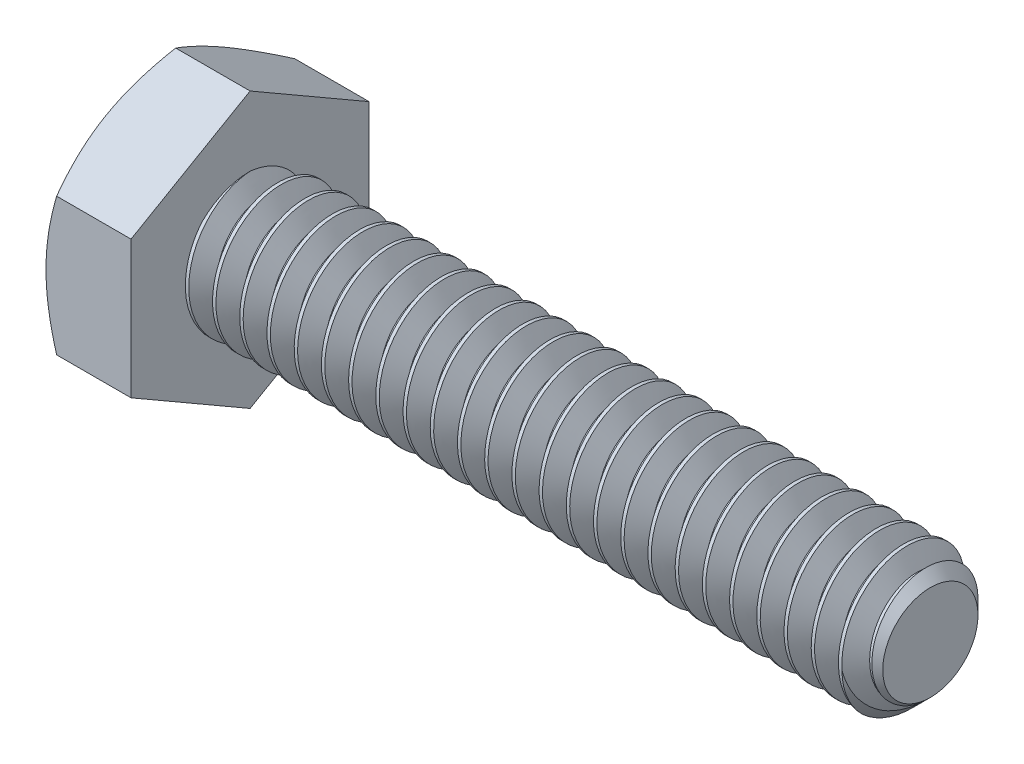
from build123d import *

# Parameters (mm, degrees)
SKETCH5_R           = 3.175
BOSS_EXTRUDE3_DEPTH = 31.75
CHAMFER1_SIZE       = 0.9525
CUT_SWEEP1_PITCH    = 1.27
BOSS_EXTRUDE4_DEPTH = 3.96875
SKETCH8_OUTSIDE_W   = 151.664
SKETCH8_OUTSIDE_H   = 153.384
SKETCH8_OUTSIDE_R   = 5.55625
CUT_EXTRUDE3_DEPTH  = 37.713261599
CUT_EXTRUDE3_DRAFT  = -60


with BuildPart() as part:
    # Sketch5 → Boss-Extrude3 (new body)
    with BuildSketch(Plane(origin=(17.859375, 0, 0), x_dir=(0, 0, -1), z_dir=(1, 0, 0))):
        Circle(SKETCH5_R)
    extrude(amount=-BOSS_EXTRUDE3_DEPTH)

    # Chamfer1
    chamfer1_edges = [part.edges().sort_by_distance(p)[0] for p in [
        (17.859375, 0, 3.175),
    ]]
    chamfer(chamfer1_edges, length=CHAMFER1_SIZE)

    # Cut-Sweep1: arcs per turn and ends read off the stored shape
    # Cut-Sweep1: the profile of Sketch10 profile screwed along a right-hand helix through 26 turns, 8 arcs to a turn; built about Z, then put on its axis
    cut_sweep1_z = Axis((0, 0, 0), (0, 0, 1))
    cut_sweep1_corners = [(3.1753, 0, 0.000173205), (2.350110803, 0, -0.47625), (2.350110803, 0, -0.635), (3.1753, 0, -1.111423205)]
    with BuildLine(mode=Mode.PRIVATE) as cut_sweep1_profile:
        Line(cut_sweep1_corners[0], cut_sweep1_corners[1])
        Line(cut_sweep1_corners[1], cut_sweep1_corners[2])
        Line(cut_sweep1_corners[2], cut_sweep1_corners[3])
        Line(cut_sweep1_corners[3], cut_sweep1_corners[0])
    cut_sweep1_cap = Face(cut_sweep1_profile.wire())
    cut_sweep1_turn_angles = [0, 22.5, 45, 67.5, 90, 112.5, 135, 157.5, 180, 202.5, 225, 247.5, 270, 292.5, 315, 337.5, 360]
    cut_sweep1_turn_weights = [1, 0.9238795325112867, 1, 0.9238795325112867, 1, 0.9238795325112867, 1, 0.9238795325112867, 1, 0.9238795325112867, 1, 0.9238795325112867, 1, 0.9238795325112867, 1, 0.9238795325112867, 1]
    cut_sweep1_turn_rails = [Edge.make_bspline([Vector(p[0], p[1], 0).rotate(cut_sweep1_z, cut_sweep1_turn_angles[k]) / cut_sweep1_turn_weights[k] + Vector(0, 0, p[2] + CUT_SWEEP1_PITCH * cut_sweep1_turn_angles[k] / 360) for k in range(17)], [0, 0, 0, 1, 1, 2, 2, 3, 3, 4, 4, 5, 5, 6, 6, 7, 7, 8, 8, 8], 2, cut_sweep1_turn_weights) for p in cut_sweep1_corners]
    cut_sweep1_turn_sides = [Face.make_surface_from_curves(cut_sweep1_turn_rails[p[0]], cut_sweep1_turn_rails[p[1]]) for p in [(0, 1), (1, 2), (2, 3), (3, 0)]]
    cut_sweep1 = Plane(origin=(17.859375, 0, 0), x_dir=(0, 1, 0), z_dir=(-1, 0, 0)) * Solid(Shell([*[p.moved(Location((0, 0, CUT_SWEEP1_PITCH * i))) for i in range(26) for p in cut_sweep1_turn_sides], cut_sweep1_cap, cut_sweep1_cap.rotate(cut_sweep1_z, 9360).moved(Location((0, 0, CUT_SWEEP1_PITCH * 9360 / 360)))]))
    add(cut_sweep1, mode=Mode.SUBTRACT)

    # Sketch6 → Boss-Extrude4 (add)
    with BuildSketch(Plane.ZY.offset(13.890625)):
        Polygon((5.55625, 3.207902433), (0, 6.415804866), (-5.55625, 3.207902433), (-5.55625, -3.207902433), (0, -6.415804866), (5.55625, -3.207902433), align=None)
    extrude(amount=BOSS_EXTRUDE4_DEPTH)


with BuildPart() as cut_extrude3_tool:
    # Sketch8 outside → Cut-Extrude3 (with draft: the straight prism first)
    with BuildSketch(Plane.ZY.offset(17.859375)):
        Rectangle(SKETCH8_OUTSIDE_W, SKETCH8_OUTSIDE_H)
        Circle(SKETCH8_OUTSIDE_R, mode=Mode.SUBTRACT)
    extrude(amount=-CUT_EXTRUDE3_DEPTH)
    # Cut-Extrude3: the draft: its side faces are tilted about the plane it starts from
    cut_extrude3_sides = [cut_extrude3_tool.faces().sort_by_distance(p)[0] for p in [
        (0.9972558, -76.692, 0),
        (0.9972558, 0, 75.832),
        (0.9972558, 76.692, 0),
        (0.9972558, 0, -75.832),
        (0.9972558, 0, -5.55625),
    ]]
    draft(cut_extrude3_sides, Plane.ZY.offset(17.859375), CUT_EXTRUDE3_DRAFT)


with BuildPart() as part_1:
    add(part.part)

    # Cut-Extrude3: cut by cut_extrude3_tool
    add(cut_extrude3_tool.part, mode=Mode.SUBTRACT)


solid = part_1.part
